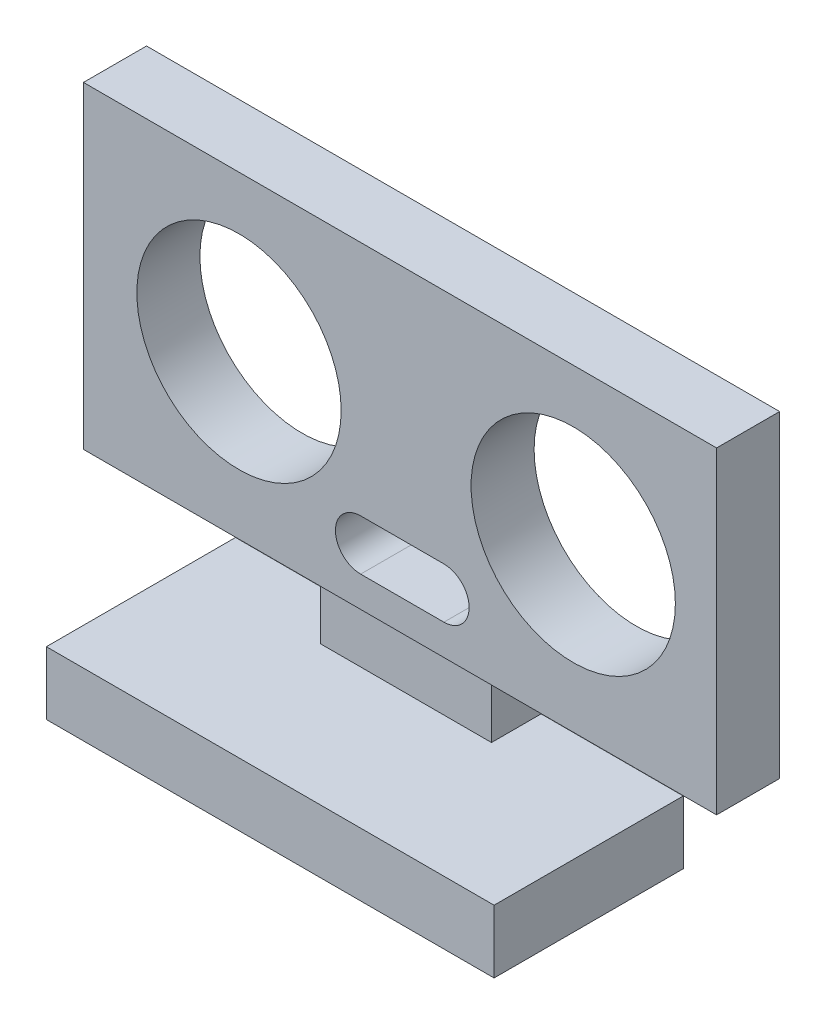
from build123d import *

# Parameters (mm, degrees)
SKETCH1_W           = 35.5
SKETCH1_H           = 15
BOSS_EXTRUDE7_DEPTH = 5
SKETCH5_W           = 13.567085075
SKETCH5_H           = 3.932792286
BOSS_EXTRUDE8_DEPTH = 5
SKETCH6_W           = 50.2
SKETCH6_H           = 5
BOSS_EXTRUDE9_DEPTH = 25.2
SKETCH7_R           = 8.1
CUT_EXTRUDE1_DEPTH  = 10
CUT_EXTRUDE2_DEPTH  = 10


with BuildPart() as part:
    # Sketch1 → Boss-Extrude7 (new body)
    with BuildSketch(Plane(origin=(0, 0, 0), x_dir=(1, 0, 0), z_dir=(0, 1, 0))):
        with Locations((32.254129859, 13.775388257)):
            Rectangle(SKETCH1_W, SKETCH1_H)
    extrude(amount=BOSS_EXTRUDE7_DEPTH)

    # Sketch5 → Boss-Extrude8 (add)
    with BuildSketch(Plane(origin=(0, 5, 0), x_dir=(1, 0, 0), z_dir=(0, 1, 0))):
        with Locations((31.950040022, 19.308992114)):
            Rectangle(SKETCH5_W, SKETCH5_H)
    extrude(amount=BOSS_EXTRUDE8_DEPTH)

    # Sketch6 → Boss-Extrude9 (add)
    with BuildSketch(Plane(origin=(1.124638213, 10, 0), x_dir=(1, 0, 0), z_dir=(0, 1, 0))):
        with Locations((31.402213384, 18.794771585)):
            Rectangle(SKETCH6_W, SKETCH6_H)
    extrude(amount=BOSS_EXTRUDE9_DEPTH)

    # Sketch7 → Cut-Extrude1 (cut)
    with BuildSketch(Plane.XY.offset(-16.294771585)):
        with Locations((46.258900119, 22.875876323)):
            Circle(SKETCH7_R)
        with Locations((19.758900119, 22.875876323)):
            Circle(SKETCH7_R)
    extrude(amount=-CUT_EXTRUDE1_DEPTH, mode=Mode.SUBTRACT)

    # Sketch7<3> → Cut-Extrude2 (cut)
    with BuildSketch(Plane.XY.offset(-16.294771585)):
        with BuildLine():
            Line((36.006107041, 16.425745395), (29.406107041, 16.425745395))
            ThreePointArc((29.406107041, 16.425745395), (27.406107041, 14.425745395), (29.406107041, 12.425745395))
            Line((29.406107041, 12.425745395), (36.006107041, 12.425745395))
            ThreePointArc((36.006107041, 12.425745395), (38.006107041, 14.425745395), (36.006107041, 16.425745395))
        make_face()
    extrude(amount=-CUT_EXTRUDE2_DEPTH, mode=Mode.SUBTRACT)


solid = part.part
